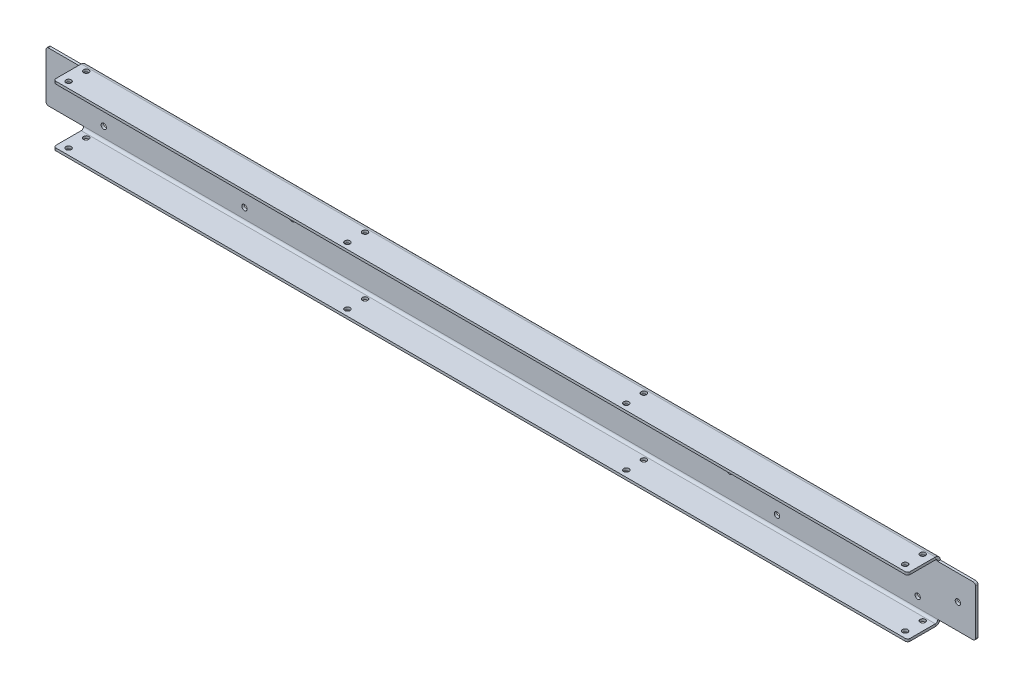
from build123d import *

# Parameters (mm, degrees)
SKETCH1_W                        = 1079.5
SKETCH1_H                        = 63.5
BASE_FLANGE1_DEPTH               = 3.175
EDGE_FLANGE4_DEPTH               = 1079.5
EDGE_FLANGE4_BEND_DEPTH          = 1079.5
EDGE_FLANGE1_DEPTH               = 63.5
EDGE_FLANGE1_BEND_DEPTH          = 63.5
F_17_64_0_26563_DIAMETER_HOLE1_D = 6.747002
F_11_32_0_34375_DIAMETER_HOLE1_D = 8.73125
CUT_EXTRUDE1_DEPTH               = 600.469933045
FILLET1_R                        = 3.175
F_17_64_0_26563_DIAMETER_HOLE2_D = 6.747002
F_17_64_0_26563_DIAMETER_HOLE3_D = 6.747002


# Sheet-metal steps are written as plain solids
with BuildPart() as part:
    # Sketch1 → Base-Flange1 (new body)
    with BuildSketch(Plane.XY):
        Rectangle(SKETCH1_W, SKETCH1_H)
    extrude(amount=-BASE_FLANGE1_DEPTH)

    # Edge-Flange4 section (across the edge) → Edge-Flange4 (add)
    with BuildSketch(Plane(origin=(-539.75, -34.925, 0), x_dir=(0, 1, 0), z_dir=(1, 0, 0))):
        with BuildLine():
            Line((-3.175, 3.175), (-3.175, 38.1))
            Line((-3.175, 38.1), (0, 38.1))
            Line((0, 38.1), (0, 3.175))
            ThreePointArc((0, 3.175), (0.92993597, 0.92993597), (3.175, 0))
            Line((3.175, 0), (3.175, -3.175))
            ThreePointArc((3.175, -3.175), (-1.315128061, -1.315128061), (-3.175, 3.175))
        make_face()
    extrude(amount=EDGE_FLANGE4_DEPTH)

    # Edge-Flange4 section 2 (across the edge) → Edge-Flange4 bend (add)
    with BuildSketch(Plane(origin=(539.75, 34.925, 0), x_dir=(0, -1, 0), z_dir=(-1, 0, 0))):
        with BuildLine():
            Line((-3.175, 3.175), (-3.175, 38.1))
            Line((-3.175, 38.1), (0, 38.1))
            Line((0, 38.1), (0, 3.175))
            ThreePointArc((0, 3.175), (0.92993597, 0.92993597), (3.175, 0))
            Line((3.175, 0), (3.175, -3.175))
            ThreePointArc((3.175, -3.175), (-1.315128061, -1.315128061), (-3.175, 3.175))
        make_face()
    extrude(amount=EDGE_FLANGE4_BEND_DEPTH)

    # Edge-Flange1 section (across the edge) → Edge-Flange1 (add)
    with BuildSketch(Plane(origin=(-590.55, 31.75, 0), x_dir=(1, 0, 0), z_dir=(0, -1, 0))):
        with BuildLine():
            Line((-3.175, 3.175), (-3.175, 44.45))
            Line((-3.175, 44.45), (0, 44.45))
            Line((0, 44.45), (0, 3.175))
            ThreePointArc((0, 3.175), (0.92993597, 0.92993597), (3.175, 0))
            Line((3.175, 0), (50.8, 0))
            Line((50.8, 0), (50.8, -3.175))
            Line((50.8, -3.175), (3.175, -3.175))
            ThreePointArc((3.175, -3.175), (-1.315128061, -1.315128061), (-3.175, 3.175))
        make_face()
    extrude(amount=EDGE_FLANGE1_DEPTH)

    # Edge-Flange1 section 2 (across the edge) → Edge-Flange1 bend (add)
    with BuildSketch(Plane(origin=(590.55, -31.75, 0), x_dir=(-1, 0, 0), z_dir=(0, 1, 0))):
        with BuildLine():
            Line((-3.175, 3.175), (-3.175, 44.45))
            Line((-3.175, 44.45), (0, 44.45))
            Line((0, 44.45), (0, 3.175))
            ThreePointArc((0, 3.175), (0.92993597, 0.92993597), (3.175, 0))
            Line((3.175, 0), (50.8, 0))
            Line((50.8, 0), (50.8, -3.175))
            Line((50.8, -3.175), (3.175, -3.175))
            ThreePointArc((3.175, -3.175), (-1.315128061, -1.315128061), (-3.175, 3.175))
        make_face()
    extrude(amount=EDGE_FLANGE1_BEND_DEPTH)

    # 17/64 (0.26563) Diameter Hole1 (through all)
    with Locations(Plane(origin=(0, 0, -3.175), x_dir=(-1, 0, 0), z_dir=(0, 0, -1))):
        with Locations((-565.15, 0), (565.15, 0)):
            Hole(F_17_64_0_26563_DIAMETER_HOLE1_D / 2)

    # 11/32 (0.34375) Diameter Hole1 (through all)
    with Locations(Plane(origin=(0, 0, -3.175), x_dir=(-1, 0, 0), z_dir=(0, 0, -1))):
        with Locations((-276.225, 0), (276.225, 0)):
            Hole(F_11_32_0_34375_DIAMETER_HOLE1_D / 2)

    # Sketch50 → Cut-Extrude1 (cut, through all)
    with BuildSketch(Plane(origin=(0, 31.75, 0), x_dir=(1, 0, 0), z_dir=(0, 1, 0))):
        with BuildLine():
            Line((590.55, -3.175), (590.55, -44.45))
            Line((590.55, -44.45), (593.725, -44.45))
            Line((593.725, -44.45), (593.725, -3.175))
            ThreePointArc((593.725, -3.175), (591.865128061, 1.315128061), (587.375, 3.175))
            Line((587.375, 3.175), (587.375, 0))
            ThreePointArc((587.375, 0), (589.62006403, -0.92993597), (590.55, -3.175))
        make_face()
        with BuildLine():
            Line((-593.725, -3.175), (-593.725, -44.45))
            Line((-593.725, -44.45), (-590.55, -44.45))
            Line((-590.55, -44.45), (-590.55, -3.175))
            ThreePointArc((-590.55, -3.175), (-589.62006403, -0.92993597), (-587.375, 0))
            Line((-587.375, 0), (-587.375, 3.175))
            ThreePointArc((-587.375, 3.175), (-591.865128061, 1.315128061), (-593.725, -3.175))
        make_face()
    extrude(amount=-CUT_EXTRUDE1_DEPTH, mode=Mode.SUBTRACT)

    # Fillet1
    fillet1_edges = [part.edges().sort_by_distance(p)[0] for p in [
        (-539.75, -36.5125, 38.1),
        (539.75, -36.5125, 38.1),
        (539.75, 36.5125, 38.1),
        (-539.75, 36.5125, 38.1),
        (-587.375, 31.75, -1.5875),
        (-587.375, -31.75, -1.5875),
        (587.375, -31.75, -1.5875),
        (587.375, 31.75, -1.5875),
    ]]
    fillet(fillet1_edges, radius=FILLET1_R)

    # 17/64 (0.26563) Diameter Hole2 (through all)
    with Locations(Plane(origin=(0, 38.1, 0), x_dir=(1, 0, 0), z_dir=(0, 1, 0))):
        with Locations((-528.6375, -7.9375), (-528.6375, -30.1625), (-176.2125, -30.1625), (-176.2125, -7.9375), (176.2125, -7.9375), (176.2125, -30.1625), (528.6375, -7.9375), (528.6375, -30.1625)):
            Hole(F_17_64_0_26563_DIAMETER_HOLE2_D / 2)

    # 17/64 (0.26563) Diameter Hole3 (through all)
    with Locations(Plane(origin=(0, 0, -3.175), x_dir=(-1, 0, 0), z_dir=(0, 0, -1))):
        with Locations((-514.35, 19.05), (-514.35, -19.05), (-336.55, 19.05), (-336.55, -19.05), (336.55, 19.05), (336.55, -19.05), (514.35, 19.05), (514.35, -19.05)):
            Hole(F_17_64_0_26563_DIAMETER_HOLE3_D / 2)


solid = part.part
